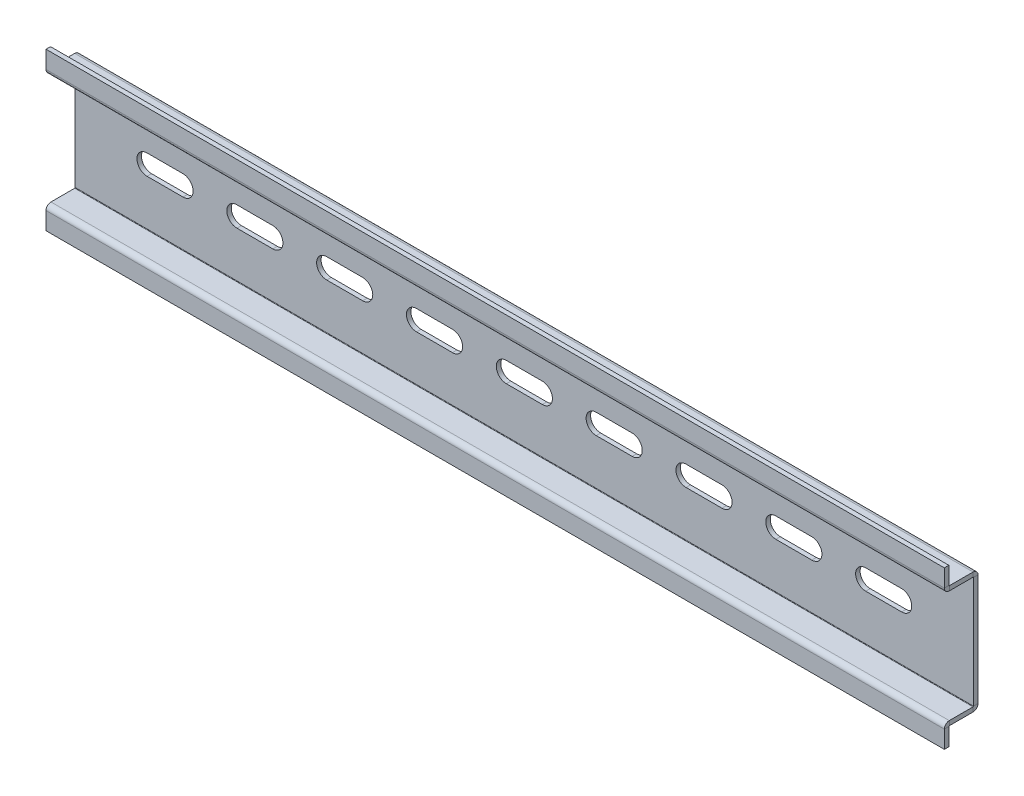
from build123d import *

# Parameters (mm, degrees)
SKETCH_1_W                         = 200
SKETCH_1_H                         = 27
SM_BASE_FLANGE_1_DEPTH             = 1
SM_EDGE_FLANGE_1_STRIP_W           = 4.2
SM_EDGE_FLANGE_1_STRIP_H           = 1
SM_EDGE_FLANGE_1_STRIP_CUT_DEPTH   = 200
SM_EDGE_FLANGE_1_STRIP_2_W         = 4.2
SM_EDGE_FLANGE_1_STRIP_2_H         = 1
SM_EDGE_FLANGE_1_STRIP_CUT_2_DEPTH = 200
SM_EDGE_FLANGE_1_DEPTH             = 200
SM_EDGE_FLANGE_1_BEND_DEPTH        = 200
SM_EDGE_FLANGE_2_STRIP_W           = 4.2
SM_EDGE_FLANGE_2_STRIP_H           = 1
SM_EDGE_FLANGE_2_STRIP_CUT_DEPTH   = 200
SM_EDGE_FLANGE_2_STRIP_2_W         = 4.2
SM_EDGE_FLANGE_2_STRIP_2_H         = 1
SM_EDGE_FLANGE_2_STRIP_CUT_2_DEPTH = 200
SM_EDGE_FLANGE_2_DEPTH             = 200
SM_EDGE_FLANGE_2_BEND_DEPTH        = 200
CUT_EXTRUDE_1_DEPTH                = 10
PATTERN_LINEAR_1_COUNT             = 5
PATTERN_LINEAR_1_PITCH             = 20
PATTERN_LINEAR_1_COL_COUNT         = 5
PATTERN_LINEAR_1_COL_PITCH         = 20


# Sheet-metal steps are written as plain solids
with BuildPart() as part:
    # Sketch 1 → 基体-法兰1 (new body)
    with BuildSketch(Plane.XY):
        Rectangle(SKETCH_1_W, SKETCH_1_H)
    extrude(amount=-SM_BASE_FLANGE_1_DEPTH)

    # 边线-法兰1 strip (across the edge) → 边线-法兰1 strip cut (cut)
    with BuildSketch(Plane(origin=(100, 13.5, 0), x_dir=(0, -1, 0), z_dir=(-1, 0, 0))):
        with Locations((-1, -0.5)):
            Rectangle(SM_EDGE_FLANGE_1_STRIP_W, SM_EDGE_FLANGE_1_STRIP_H)
    extrude(amount=SM_EDGE_FLANGE_1_STRIP_CUT_DEPTH, mode=Mode.SUBTRACT)

    # 边线-法兰1 strip 2 (across the edge) → 边线-法兰1 strip cut 2 (cut)
    with BuildSketch(Plane(origin=(-100, -13.5, 0), x_dir=(0, 1, 0), z_dir=(1, 0, 0))):
        with Locations((-1, -0.5)):
            Rectangle(SM_EDGE_FLANGE_1_STRIP_2_W, SM_EDGE_FLANGE_1_STRIP_2_H)
    extrude(amount=SM_EDGE_FLANGE_1_STRIP_CUT_2_DEPTH, mode=Mode.SUBTRACT)

    # 边线-法兰1 section (across the edge) → 边线-法兰1 (add)
    with BuildSketch(Plane(origin=(100, 13.5, 0), x_dir=(0, -1, 0), z_dir=(-1, 0, 0))):
        with BuildLine():
            Line((0, 0.1), (0, 6.5))
            Line((0, 6.5), (1, 6.5))
            Line((1, 6.5), (1, 0.1))
            ThreePointArc((1, 0.1), (1.029289322, 0.029289322), (1.1, 0))
            Line((1.1, 0), (1.1, -1))
            ThreePointArc((1.1, -1), (0.322182541, -0.677817459), (0, 0.1))
        make_face()
    extrude(amount=SM_EDGE_FLANGE_1_DEPTH)

    # 边线-法兰1 section 2 (across the edge) → 边线-法兰1 bend (add)
    with BuildSketch(Plane(origin=(-100, -13.5, 0), x_dir=(0, 1, 0), z_dir=(1, 0, 0))):
        with BuildLine():
            Line((0, 0.1), (0, 6.5))
            Line((0, 6.5), (1, 6.5))
            Line((1, 6.5), (1, 0.1))
            ThreePointArc((1, 0.1), (1.029289322, 0.029289322), (1.1, 0))
            Line((1.1, 0), (1.1, -1))
            ThreePointArc((1.1, -1), (0.322182541, -0.677817459), (0, 0.1))
        make_face()
    extrude(amount=SM_EDGE_FLANGE_1_BEND_DEPTH)

    # 边线-法兰2 strip (across the edge) → 边线-法兰2 strip cut (cut)
    with BuildSketch(Plane(origin=(-100, 13.5, 6.5), x_dir=(0, 0, -1), z_dir=(1, 0, 0))):
        with Locations((-1, -0.5)):
            Rectangle(SM_EDGE_FLANGE_2_STRIP_W, SM_EDGE_FLANGE_2_STRIP_H)
    extrude(amount=SM_EDGE_FLANGE_2_STRIP_CUT_DEPTH, mode=Mode.SUBTRACT)

    # 边线-法兰2 strip 2 (across the edge) → 边线-法兰2 strip cut 2 (cut)
    with BuildSketch(Plane(origin=(100, -13.5, 6.5), x_dir=(0, 0, -1), z_dir=(-1, 0, 0))):
        with Locations((-1, -0.5)):
            Rectangle(SM_EDGE_FLANGE_2_STRIP_2_W, SM_EDGE_FLANGE_2_STRIP_2_H)
    extrude(amount=SM_EDGE_FLANGE_2_STRIP_CUT_2_DEPTH, mode=Mode.SUBTRACT)

    # 边线-法兰2 section (across the edge) → 边线-法兰2 (add)
    with BuildSketch(Plane(origin=(-100, 13.5, 6.5), x_dir=(0, 0, -1), z_dir=(1, 0, 0))):
        with BuildLine():
            Line((0, 0.1), (0, 4))
            Line((0, 4), (1, 4))
            Line((1, 4), (1, 0.1))
            ThreePointArc((1, 0.1), (1.029289322, 0.029289322), (1.1, 0))
            Line((1.1, 0), (1.1, -1))
            ThreePointArc((1.1, -1), (0.322182541, -0.677817459), (0, 0.1))
        make_face()
    extrude(amount=SM_EDGE_FLANGE_2_DEPTH)

    # 边线-法兰2 section 2 (across the edge) → 边线-法兰2 bend (add)
    with BuildSketch(Plane(origin=(100, -13.5, 6.5), x_dir=(0, 0, -1), z_dir=(-1, 0, 0))):
        with BuildLine():
            Line((0, 0.1), (0, 4))
            Line((0, 4), (1, 4))
            Line((1, 4), (1, 0.1))
            ThreePointArc((1, 0.1), (1.029289322, 0.029289322), (1.1, 0))
            Line((1.1, 0), (1.1, -1))
            ThreePointArc((1.1, -1), (0.322182541, -0.677817459), (0, 0.1))
        make_face()
    extrude(amount=SM_EDGE_FLANGE_2_BEND_DEPTH)

    # 草图18 → 切除-拉伸1 (cut)
    with BuildSketch(Plane(origin=(0, 0, -1), x_dir=(-1, 0, 0), z_dir=(0, 0, -1))):
        with BuildLine():
            Line((-4, 2.25), (4, 2.25))
            ThreePointArc((4, 2.25), (6.25, 0), (4, -2.25))
            Line((4, -2.25), (-4, -2.25))
            ThreePointArc((-4, -2.25), (-6.25, 0), (-4, 2.25))
        make_face()
    cut_extrude_1 = extrude(amount=-CUT_EXTRUDE_1_DEPTH, mode=Mode.SUBTRACT)

    # 阵列(线性)1: 切除-拉伸1 ×5
    with Locations(*[(i * PATTERN_LINEAR_1_PITCH, 0, 0) for i in range(1, PATTERN_LINEAR_1_COUNT)]):
        add(cut_extrude_1, mode=Mode.SUBTRACT)

    # 阵列(线性)1 col: 切除-拉伸1 ×5
    with Locations(*[(-i * PATTERN_LINEAR_1_COL_PITCH, 0, 0) for i in range(1, PATTERN_LINEAR_1_COL_COUNT)]):
        add(cut_extrude_1, mode=Mode.SUBTRACT)


solid = part.part
